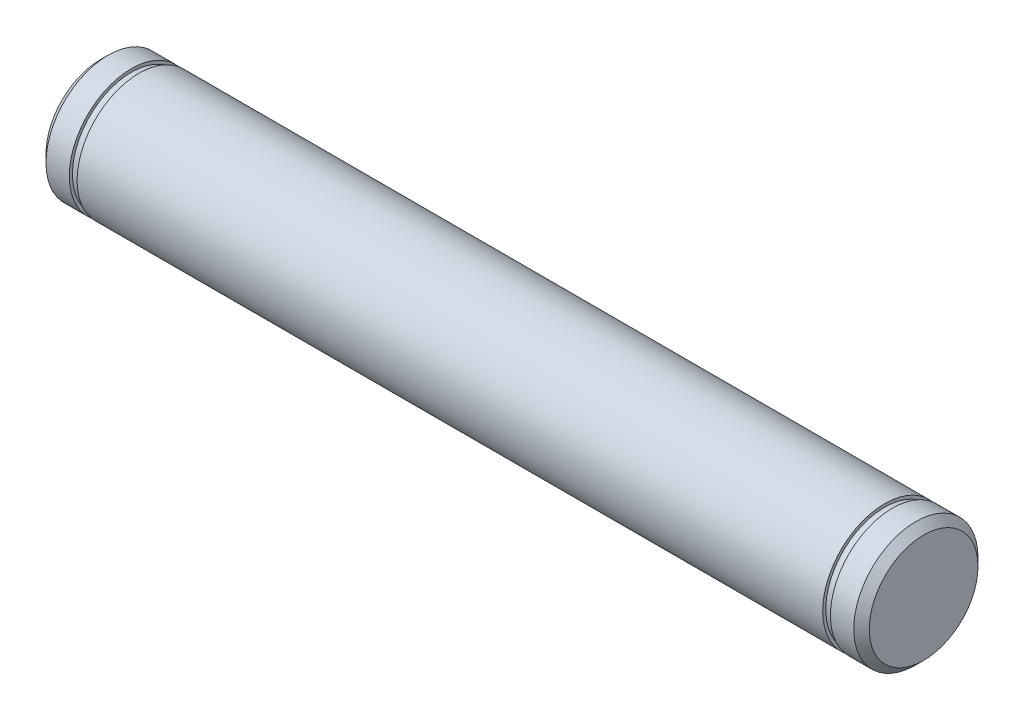
from build123d import *

# Parameters (mm, degrees)
SKETCH1_R           = 2
BOSS_EXTRUDE1_DEPTH = 26.5
CUT_EXTRUDE2_START  = -1
SKETCH2_R           = 2.498108329
SKETCH2_R_2         = 1.9
CUT_EXTRUDE2_DEPTH  = 0.25
CUT_EXTRUDE3_START  = -1.25
SKETCH3_R           = 2.5
SKETCH3_R_2         = 1.9
CUT_EXTRUDE3_DEPTH  = 0.25
CHAMFER1_SIZE       = 0.25


with BuildPart() as part:
    # Sketch1 → Boss-Extrude1 (new body)
    with BuildSketch(Plane(origin=(0, 0, 0), x_dir=(0, 0, -1), z_dir=(1, 0, 0))):
        Circle(SKETCH1_R)
    extrude(amount=BOSS_EXTRUDE1_DEPTH)

    # Sketch2 → Cut-Extrude2 (cut)
    with BuildSketch(Plane(origin=(26.5, 0, 0), x_dir=(0, 0, -1), z_dir=(1, 0, 0)).offset(CUT_EXTRUDE2_START)):
        Circle(SKETCH2_R)
        Circle(SKETCH2_R_2, mode=Mode.SUBTRACT)
    extrude(amount=-CUT_EXTRUDE2_DEPTH, mode=Mode.SUBTRACT)

    # Sketch3 → Cut-Extrude3 (cut)
    with BuildSketch(Plane.ZY.offset(CUT_EXTRUDE3_START)):
        Circle(SKETCH3_R)
        Circle(SKETCH3_R_2, mode=Mode.SUBTRACT)
    extrude(amount=CUT_EXTRUDE3_DEPTH, mode=Mode.SUBTRACT)

    # Chamfer1
    chamfer1_edges = [part.edges().sort_by_distance(p)[0] for p in [
        (0, 0, 2),
        (26.5, 0, 2),
    ]]
    chamfer(chamfer1_edges, length=CHAMFER1_SIZE)


solid = part.part
